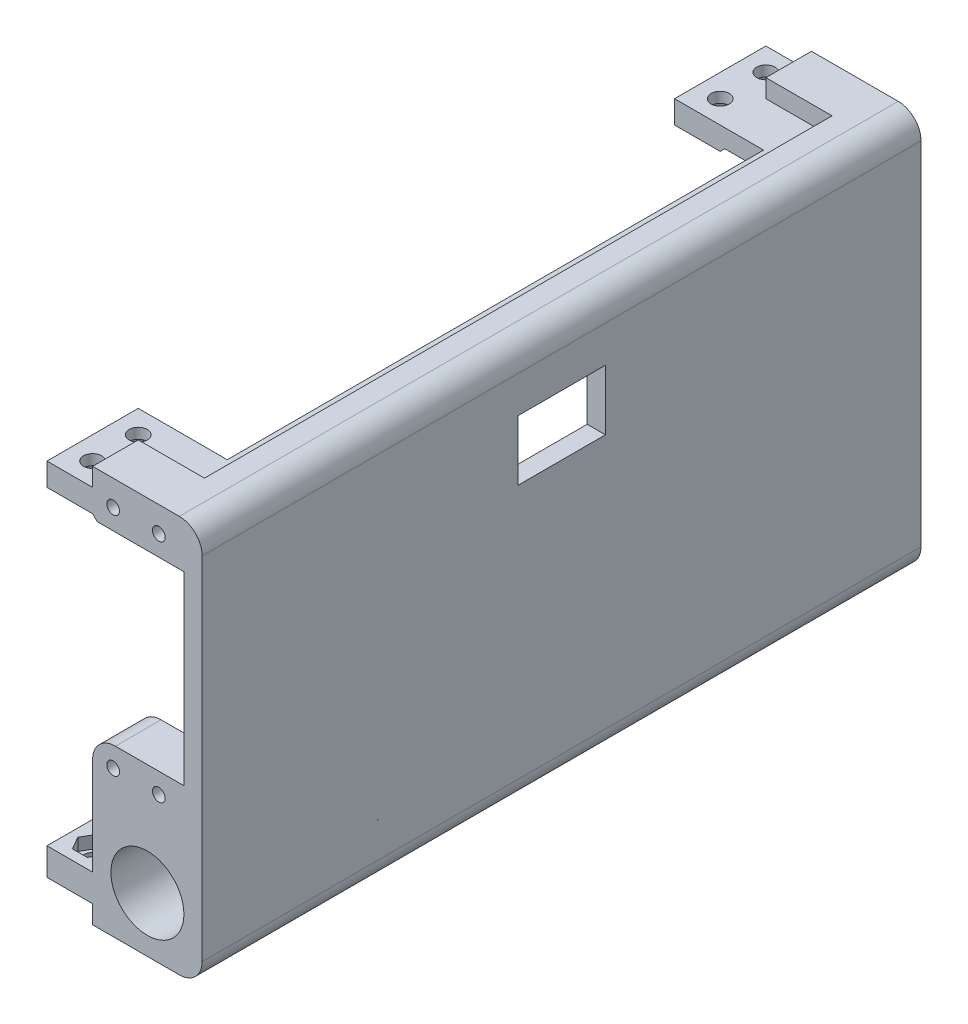
from build123d import *

# Parameters (mm, degrees)
SKETCH202_W                           = 157.5
SKETCH202_H                           = 87
CUERPO_BASE_DEPTH                     = 34
SKETCH203_W                           = 30
SKETCH203_H                           = 40.6
CAVIDAD_SERVOS_DEPTH                  = 157.5
CUT_EXTRUDE94_DEPTH                   = 26.4
SKETCH315_W                           = 15
SKETCH315_H                           = 137.5
CUT_EXTRUDE95_DEPTH                   = 6
SKETCH319_W                           = 15
SKETCH319_H                           = 137.5
CUT_EXTRUDE99_DEPTH                   = 2
SKETCH327_W                           = 30
SKETCH327_H                           = 137.5
CUT_EXTRUDE106_DEPTH                  = 2
CUT_EXTRUDE101_DEPTH                  = 4
SKETCH322_W                           = 10
SKETCH322_H                           = 157.5
CUT_EXTRUDE102_DEPTH                  = 4
CHAMFER23_SIZE                        = 4
SKETCH332_W                           = 10
SKETCH332_H                           = 10
BOSS_EXTRUDE4_DEPTH                   = 2
SKETCH338_W                           = 10
SKETCH338_H                           = 20
CUT_EXTRUDE110_DEPTH                  = 1
CHAMFER24_SIZE                        = 6
FILLET10_R                            = 5
SKETCH313_R                           = 1.4
CUT_EXTRUDE93_DEPTH                   = 12
AGUJEROS_ESTRUCTURA_REACH             = 114.315
SKETCH323_R                           = 2
AGUJEROS_ESTRUCTURA_DIRECTION_2_REACH = 114.315
TUERCAS_START                         = -2.7
TUERCAS_OUTLINE_R                     = 2
TUERCAS_DEPTH                         = 73.4
CUT_EXTRUDE107_REACH                  = 114.315
SKETCH334_R                           = 2
TUERCAS_2_DEPTH                       = 3.7
FILLET11_R                            = 5
RELLENO_PREVIO_REACH                  = 157.346
BOSS_EXTRUDE3_REACH                   = 96.836
SKETCH331_W                           = 25
SKETCH331_H                           = 16
VARILLAALUMINIO_REACH                 = 105.454
SKETCH329_R                           = 8
VARILLAALUMINIO_DIRECTION_2_DEPTH     = 10
FILLET12_R                            = 5
CUT_EXTRUDE109_REACH                  = 118.51
SKETCH337_W                           = 19.5
SKETCH337_H                           = 117.5
CHAMFER25_START                       = -78.75
CHAMFER25_DEPTH                       = 158.75
CHAMFER25_2_DEPTH                     = 20
CHAMFER25_START_2                     = 58.75
CHAMFER25_3_DEPTH                     = 20
SKETCH339_W                           = 24.5
SKETCH339_H                           = 8
SKETCH339_R                           = 1.4
BOSS_EXTRUDE5_DEPTH                   = 4
RIB2_REACH                            = 135.005
SKETCH342_WALL_W                      = 285.333984378
SKETCH342_WALL_H                      = 4
SKETCH343_R                           = 3
SKETCH343_R_2                         = 1.4
BOSS_EXTRUDE6_DEPTH                   = 4
CUT_EXTRUDE111_REACH                  = 96.836
SKETCH344_W                           = 19.2
SKETCH344_H                           = 13.2


with BuildPart() as part:
    # Sketch202 → Cuerpo_base (new body)
    with BuildSketch(Plane(origin=(22, 0, 0), x_dir=(0, 0, -1), z_dir=(1, 0, 0))):
        Rectangle(SKETCH202_W, SKETCH202_H)
    extrude(amount=-CUERPO_BASE_DEPTH)

    # Sketch203 → Cavidad_servos (cut)
    with BuildSketch(Plane(origin=(55.25, 0, 78.75), x_dir=(-1, 0, 0), z_dir=(0, 0, -1))):
        with Locations((52.25, 13.2)):
            Rectangle(SKETCH203_W, SKETCH203_H)
    extrude(amount=CAVIDAD_SERVOS_DEPTH, mode=Mode.SUBTRACT)

    # Sketch314 → Cut-Extrude94 (cut)
    with BuildSketch(Plane(origin=(0, -7.1, 0), x_dir=(1, 0, 0), z_dir=(0, 1, 0))):
        Polygon((18, 68.75), (-2, 68.75), (-2, 78.75), (-12, 78.75), (-12, -78.75), (-2, -78.75), (-2, -68.75), (18, -68.75), align=None)
    extrude(amount=-CUT_EXTRUDE94_DEPTH, mode=Mode.SUBTRACT)

    # Sketch315 → Cut-Extrude95 (cut)
    with BuildSketch(Plane(origin=(0, -33.5, 0), x_dir=(1, 0, 0), z_dir=(0, 1, 0))):
        with Locations((10.5, 0)):
            Rectangle(SKETCH315_W, SKETCH315_H)
    extrude(amount=-CUT_EXTRUDE95_DEPTH, mode=Mode.SUBTRACT)

    # Sketch319 → Cut-Extrude99 (cut)
    with BuildSketch(Plane(origin=(0, -33.5, 0), x_dir=(1, 0, 0), z_dir=(0, 1, 0))):
        with Locations((-4.5, 0)):
            Rectangle(SKETCH319_W, SKETCH319_H)
    extrude(amount=-CUT_EXTRUDE99_DEPTH, mode=Mode.SUBTRACT)

    # Sketch327 → Cut-Extrude106 (cut)
    with BuildSketch(Plane.XZ.offset(-33.5)):
        with Locations((3, 0)):
            Rectangle(SKETCH327_W, SKETCH327_H)
    extrude(amount=-CUT_EXTRUDE106_DEPTH, mode=Mode.SUBTRACT)

    # Sketch321 → Cut-Extrude101 (cut)
    with BuildSketch(Plane(origin=(0, 43.5, 0), x_dir=(1, 0, 0), z_dir=(0, 1, 0))):
        Polygon((-12, 78.75), (-2, 78.75), (-2, 68.75), (12.5, 68.75), (12.5, -68.75), (-2, -68.75), (-2, -78.75), (-12, -78.75), align=None)
    extrude(amount=-CUT_EXTRUDE101_DEPTH, mode=Mode.SUBTRACT)

    # Sketch322 → Cut-Extrude102 (cut)
    with BuildSketch(Plane.XZ.offset(43.5)):
        with Locations((-7, 0)):
            Rectangle(SKETCH322_W, SKETCH322_H)
    extrude(amount=-CUT_EXTRUDE102_DEPTH, mode=Mode.SUBTRACT)

    # Chamfer23
    chamfer23_edges = [part.edges().sort_by_distance(p)[0] for p in [
        (18, -39.5, 0),
        (3, -39.5, 0),
    ]]
    chamfer(chamfer23_edges, length=CHAMFER23_SIZE - 0.0001)  # a hair under: the kernel refuses the full size

    # Sketch332 → Boss-Extrude4 (add)
    with BuildSketch(Plane.XZ.offset(-35.5)):
        with Locations((-7, -63.75)):
            Rectangle(SKETCH332_W, SKETCH332_H)
        with Locations((-7, 63.75)):
            Rectangle(SKETCH332_W, SKETCH332_H)
    extrude(amount=BOSS_EXTRUDE4_DEPTH)

    # Sketch338 → Cut-Extrude110 (cut)
    with BuildSketch(Plane.XZ.offset(-33.5)):
        with Locations((-7, -68.75)):
            Rectangle(SKETCH338_W, SKETCH338_H)
        with Locations((-7, 68.75)):
            Rectangle(SKETCH338_W, SKETCH338_H)
    extrude(amount=-CUT_EXTRUDE110_DEPTH, mode=Mode.SUBTRACT)

    # Chamfer24
    chamfer24_edges = [part.edges().sort_by_distance(p)[0] for p in [
        (10.5, -39.5, 68.75),
        (10.5, -39.5, -68.75),
    ]]
    chamfer(chamfer24_edges, length=CHAMFER24_SIZE)

    # Fillet10
    fillet10_edges = [part.edges().sort_by_distance(p)[0] for p in [
        (22, -43.5, 0),
        (22, 43.5, 0),
    ]]
    fillet(fillet10_edges, radius=FILLET10_R)

    # Sketch313 → Cut-Extrude93 (cut)
    with BuildSketch(Plane.XY.offset(78.75)):
        with Locations((12.5, 37.95)):
            Circle(SKETCH313_R)
        with Locations((2.5, 37.95)):
            Circle(SKETCH313_R)
        with Locations((2.5, -11.55)):
            Circle(SKETCH313_R)
        with Locations((12.5, -11.55)):
            Circle(SKETCH313_R)
    cut_extrude93 = extrude(amount=-CUT_EXTRUDE93_DEPTH, mode=Mode.SUBTRACT)

    # Mirror1: Cut-Extrude93 across plane
    add(cut_extrude93.mirror(Plane.XY), mode=Mode.SUBTRACT)

    # Sketch323 → Agujeros_Estructura (cut, up to next)
    with BuildSketch(Plane(origin=(0, -33.5, 0), x_dir=(1, 0, 0), z_dir=(0, 1, 0)), mode=Mode.PRIVATE) as agujeros_estructura_sk1:
        with Locations(Location((-7, -73.75, 0), (0, 0, 90))):
            Circle(SKETCH323_R)
    agujeros_estructura_tool1 = extrude(agujeros_estructura_sk1.sketch, amount=-AGUJEROS_ESTRUCTURA_REACH, mode=Mode.PRIVATE) & part.part
    # Sketch323 → Agujeros_Estructura (cut, up to next)
    with BuildSketch(Plane(origin=(0, -33.5, 0), x_dir=(1, 0, 0), z_dir=(0, 1, 0)), mode=Mode.PRIVATE) as agujeros_estructura_sk2:
        with Locations(Location((-7, 73.75, 0), (0, 0, 270))):
            Circle(SKETCH323_R)
    agujeros_estructura_tool2 = extrude(agujeros_estructura_sk2.sketch, amount=-AGUJEROS_ESTRUCTURA_REACH, mode=Mode.PRIVATE) & part.part
    add(agujeros_estructura_tool1.solids().sort_by_distance((-7, -33.5, 73.75))[0], mode=Mode.SUBTRACT)
    add(agujeros_estructura_tool2.solids().sort_by_distance((-7, -33.5, -73.75))[0], mode=Mode.SUBTRACT)

    # Sketch323 → Agujeros_Estructura direction 2 (cut, up to next)
    with BuildSketch(Plane(origin=(0, -33.5, 0), x_dir=(1, 0, 0), z_dir=(0, 1, 0)), mode=Mode.PRIVATE) as agujeros_estructura_direction_2_sk1:
        with Locations(Location((-7, -73.75, 0), (0, 0, 90))):
            Circle(SKETCH323_R)
    agujeros_estructura_direction_2_tool1 = extrude(agujeros_estructura_direction_2_sk1.sketch, amount=AGUJEROS_ESTRUCTURA_DIRECTION_2_REACH, mode=Mode.PRIVATE) & part.part
    # Sketch323 → Agujeros_Estructura direction 2 (cut, up to next)
    with BuildSketch(Plane(origin=(0, -33.5, 0), x_dir=(1, 0, 0), z_dir=(0, 1, 0)), mode=Mode.PRIVATE) as agujeros_estructura_direction_2_sk2:
        with Locations(Location((-7, 73.75, 0), (0, 0, 270))):
            Circle(SKETCH323_R)
    agujeros_estructura_direction_2_tool2 = extrude(agujeros_estructura_direction_2_sk2.sketch, amount=AGUJEROS_ESTRUCTURA_DIRECTION_2_REACH, mode=Mode.PRIVATE) & part.part
    add(agujeros_estructura_direction_2_tool1.solids().sort_by_distance((-7, -33.5, 73.75))[0], mode=Mode.SUBTRACT)
    add(agujeros_estructura_direction_2_tool2.solids().sort_by_distance((-7, -33.5, -73.75))[0], mode=Mode.SUBTRACT)

    # Tuercas: read off the stored shape, not the designer's step
    # Tuercas outline → Tuercas (cut)
    # profile 1 of 2: a face of its own
    with BuildSketch(Plane(origin=(0, -33.5, 0), x_dir=(1, 0, 0), z_dir=(0, 1, 0)).offset(TUERCAS_START)):
        Polygon((-5.383419246, -70.95), (-8.616580754, -70.95), (-10.233161507, -73.75), (-8.616580754, -76.55), (-5.383419246, -76.55), (-3.766838493, -73.75), align=None)
        with Locations((-7, -73.75)):
            Circle(TUERCAS_OUTLINE_R, mode=Mode.SUBTRACT)
    # profile 2 of 2: a face of its own
    with BuildSketch(Plane(origin=(0, -33.5, 0), x_dir=(1, 0, 0), z_dir=(0, 1, 0)).offset(TUERCAS_START)):
        Polygon((-5.383419246, 76.55), (-8.616580754, 76.55), (-10.233161507, 73.75), (-8.616580754, 70.95), (-5.383419246, 70.95), (-3.766838493, 73.75), align=None)
        with Locations((-7, 73.75)):
            Circle(TUERCAS_OUTLINE_R, mode=Mode.SUBTRACT)
    extrude(amount=TUERCAS_DEPTH, mode=Mode.SUBTRACT)

    # Sketch334 → Cut-Extrude107 (cut, up to next)
    with BuildSketch(Plane.XZ.offset(-33.5), mode=Mode.PRIVATE) as cut_extrude107_sk1:
        with Locations(Location((-7, -63.75, 0), (0, 0, 90))):
            Circle(SKETCH334_R)
    cut_extrude107_tool1 = extrude(cut_extrude107_sk1.sketch, amount=-CUT_EXTRUDE107_REACH, mode=Mode.PRIVATE) & part.part
    # Sketch334 → Cut-Extrude107 (cut, up to next)
    with BuildSketch(Plane.XZ.offset(-33.5), mode=Mode.PRIVATE) as cut_extrude107_sk2:
        with Locations(Location((-7, 63.75, 0), (0, 0, 270))):
            Circle(SKETCH334_R)
    cut_extrude107_tool2 = extrude(cut_extrude107_sk2.sketch, amount=-CUT_EXTRUDE107_REACH, mode=Mode.PRIVATE) & part.part
    add(cut_extrude107_tool1.solids().sort_by_distance((-7, 33.5, -63.75))[0], mode=Mode.SUBTRACT)
    add(cut_extrude107_tool2.solids().sort_by_distance((-7, 33.5, 63.75))[0], mode=Mode.SUBTRACT)

    # Sketch335 → Tuercas_2 (cut)
    with BuildSketch(Plane.XZ.offset(-33.5)):
        Polygon((-10.233161507, -63.75), (-8.616580754, -66.55), (-5.383419246, -66.55), (-3.766838493, -63.75), (-5.383419246, -60.95), (-8.616580754, -60.95), align=None)
        Polygon((-8.616580754, 60.95), (-10.233161507, 63.75), (-8.616580754, 66.55), (-5.383419246, 66.55), (-3.766838493, 63.75), (-5.383419246, 60.95), align=None)
    extrude(amount=-TUERCAS_2_DEPTH, mode=Mode.SUBTRACT)

    # Fillet11
    fillet11_edges = [part.edges().sort_by_distance(p)[0] for p in [
        (-2, -7.1, -73.75),
        (-2, -7.1, 73.75),
    ]]
    fillet(fillet11_edges, radius=FILLET11_R)

    # Relleno previo: up to this face of the body (flat: up to its plane)
    relleno_previo_end = Plane(part.part.faces().sort_by_distance((8.105455585, -20.638186565, -68.75))[0])
    # Sketch330 → Relleno previo (add, up to the picked face)
    with BuildSketch(Plane(origin=(0, 0, 68.75), x_dir=(-1, 0, 0), z_dir=(0, 0, -1)), mode=Mode.PRIVATE) as relleno_previo_sk1:
        Polygon((-3, -35.5), (-18, -31.5), (-18, -39.5), (-3, -39.5), align=None)
    relleno_previo_tool1 = split(extrude(relleno_previo_sk1.sketch, amount=RELLENO_PREVIO_REACH, mode=Mode.PRIVATE), bisect_by=relleno_previo_end, keep=Keep.BOTH, mode=Mode.PRIVATE)
    add(relleno_previo_tool1.solids().sort_by(Axis((11.333333, -36.388889, 68.75), (0, 0, -1)))[0])

    # Boss-Extrude3: up to this face of the body (flat: up to its plane)
    boss_extrude3_end = Plane(part.part.faces().sort_by_distance((-2, -22.8, -73.75))[0])
    # Sketch331 → Boss-Extrude3 (add, up to the picked face)
    with BuildSketch(Plane.ZY.offset(-18), mode=Mode.PRIVATE) as boss_extrude3_sk1:
        with Locations((0, -27.5)):
            Rectangle(SKETCH331_W, SKETCH331_H)
    boss_extrude3_tool1 = split(extrude(boss_extrude3_sk1.sketch, amount=BOSS_EXTRUDE3_REACH, mode=Mode.PRIVATE), bisect_by=boss_extrude3_end, keep=Keep.BOTH, mode=Mode.PRIVATE)
    add(boss_extrude3_tool1.solids().sort_by(Axis((18, -27.5, 0), (-1, 0, 0)))[0])

    # Sketch329 → VarillaAluminio (cut, up to next)
    with BuildSketch(Plane(origin=(0, 0, 12.5), x_dir=(-1, 0, 0), z_dir=(0, 0, -1)), mode=Mode.PRIVATE) as varillaaluminio_sk1:
        with Locations(Location((-10, -31.5, 0), (0, 0, 180))):
            Circle(SKETCH329_R)
    varillaaluminio_tool1 = extrude(varillaaluminio_sk1.sketch, amount=-VARILLAALUMINIO_REACH, mode=Mode.PRIVATE) & part.part
    varillaaluminio = varillaaluminio_tool1.solids().sort_by_distance((10, -31.5, 12.5))[0]
    add(varillaaluminio, mode=Mode.SUBTRACT)

    # Sketch329 → VarillaAluminio direction 2 (cut)
    with BuildSketch(Plane(origin=(0, 0, 12.5), x_dir=(-1, 0, 0), z_dir=(0, 0, -1))):
        with Locations(Location((-10, -31.5, 0), (0, 0, 180))):
            Circle(SKETCH329_R)
    varillaaluminio_direction_2 = extrude(amount=VARILLAALUMINIO_DIRECTION_2_DEPTH, mode=Mode.SUBTRACT)

    # Mirror2: VarillaAluminio, VarillaAluminio direction 2 across plane
    add(varillaaluminio.mirror(Plane.XY), mode=Mode.SUBTRACT)
    add(varillaaluminio_direction_2.mirror(Plane.XY), mode=Mode.SUBTRACT)

    # Fillet12
    fillet12_edges = [part.edges().sort_by_distance(p)[0] for p in [
        (-2, -19.5, 0),
    ]]
    fillet(fillet12_edges, radius=FILLET12_R)

    # Sketch337 → Cut-Extrude109 (cut, up to next)
    with BuildSketch(Plane(origin=(0, 39.5, 0), x_dir=(1, 0, 0), z_dir=(0, 1, 0)), mode=Mode.PRIVATE) as cut_extrude109_sk1:
        with Locations((-2.25, 0)):
            Rectangle(SKETCH337_W, SKETCH337_H)
    cut_extrude109_tool1 = extrude(cut_extrude109_sk1.sketch, amount=-CUT_EXTRUDE109_REACH, mode=Mode.PRIVATE) & part.part
    add(cut_extrude109_tool1.solids().sort_by_distance((-2.25, 39.5, 0))[0], mode=Mode.SUBTRACT)

    # Chamfer25: read off the stored shape, not the designer's step
    # Chamfer25 outline → Chamfer25 (cut)
    with BuildSketch(Plane.XY.offset(CHAMFER25_START)):
        Polygon((-1, 33.5), (-2, 34.5), (-2, 33.5), align=None)
    extrude(amount=CHAMFER25_DEPTH, mode=Mode.SUBTRACT)

    # Chamfer25 2 outline → Chamfer25 2 (add)
    with BuildSketch(Plane.XY.offset(CHAMFER25_START)):
        Polygon((-2, 35.5), (-2, 34.5), (-1, 35.5), align=None)
    extrude(amount=CHAMFER25_2_DEPTH)

    # Chamfer25 3 outline → Chamfer25 3 (add)
    with BuildSketch(Plane.XY.offset(CHAMFER25_START_2)):
        Polygon((-2, 35.5), (-2, 34.5), (-1, 35.5), align=None)
    extrude(amount=CHAMFER25_3_DEPTH)

    # Sketch339 → Boss-Extrude5 (add)
    with BuildSketch(Plane(origin=(0, 23.5, 0), x_dir=(1, 0, 0), z_dir=(0, 1, 0))):
        with Locations((5.75, 45)):
            Rectangle(SKETCH339_W, SKETCH339_H)
        with Locations(Location((-2.5, 45, 0), (0, 0, 270))):
            Circle(SKETCH339_R, mode=Mode.SUBTRACT)
    boss_extrude5 = extrude(amount=-BOSS_EXTRUDE5_DEPTH)

    # Sketch342 wall → Rib2 (add, up to next)
    with BuildSketch(Plane(origin=(11.875, 13.375, -45), x_dir=(0.707106781187, -0.707106781187, 0), z_dir=(-0.707106781187, -0.707106781187, 0)), mode=Mode.PRIVATE) as rib2_sk1:
        Rectangle(SKETCH342_WALL_W, SKETCH342_WALL_H)
    rib2_tool1 = extrude(rib2_sk1.sketch, amount=-RIB2_REACH, mode=Mode.PRIVATE) - part.part
    rib2 = rib2_tool1.solids().sort_by_distance((11.875, 13.375, -45))[0]
    add(rib2)

    # Mirror3: Boss-Extrude5, Rib2 across plane
    add(boss_extrude5.mirror(Plane.XY))
    add(rib2.mirror(Plane.XY))

    # Sketch343 → Boss-Extrude6 (add)
    # profile 1 of 4: a face of its own
    with BuildSketch(Plane.ZY.offset(-18)):
        with Locations((-28.25, -10.5)):
            Circle(SKETCH343_R)
        with Locations((-28.25, -10.5)):
            Circle(SKETCH343_R_2, mode=Mode.SUBTRACT)
    # profile 2 of 4: a face of its own
    with BuildSketch(Plane.ZY.offset(-18)):
        with Locations((-28.25, 10.5)):
            Circle(SKETCH343_R)
        with Locations((-28.25, 10.5)):
            Circle(SKETCH343_R_2, mode=Mode.SUBTRACT)
    # profile 3 of 4: a face of its own
    with BuildSketch(Plane.ZY.offset(-18)):
        with Locations((28.25, 10.5)):
            Circle(SKETCH343_R)
        with Locations((28.25, 10.5)):
            Circle(SKETCH343_R_2, mode=Mode.SUBTRACT)
    # profile 4 of 4: a face of its own
    with BuildSketch(Plane.ZY.offset(-18)):
        with Locations((28.25, -10.5)):
            Circle(SKETCH343_R)
        with Locations((28.25, -10.5)):
            Circle(SKETCH343_R_2, mode=Mode.SUBTRACT)
    extrude(amount=BOSS_EXTRUDE6_DEPTH)

    # Sketch344 → Cut-Extrude111 (cut, up to next)
    with BuildSketch(Plane.ZY.offset(-18), mode=Mode.PRIVATE) as cut_extrude111_sk1:
        with Locations((0, 23.9)):
            Rectangle(SKETCH344_W, SKETCH344_H)
    cut_extrude111_tool1 = extrude(cut_extrude111_sk1.sketch, amount=-CUT_EXTRUDE111_REACH, mode=Mode.PRIVATE) & part.part
    add(cut_extrude111_tool1.solids().sort_by_distance((18, 23.9, 0))[0], mode=Mode.SUBTRACT)


solid = part.part
